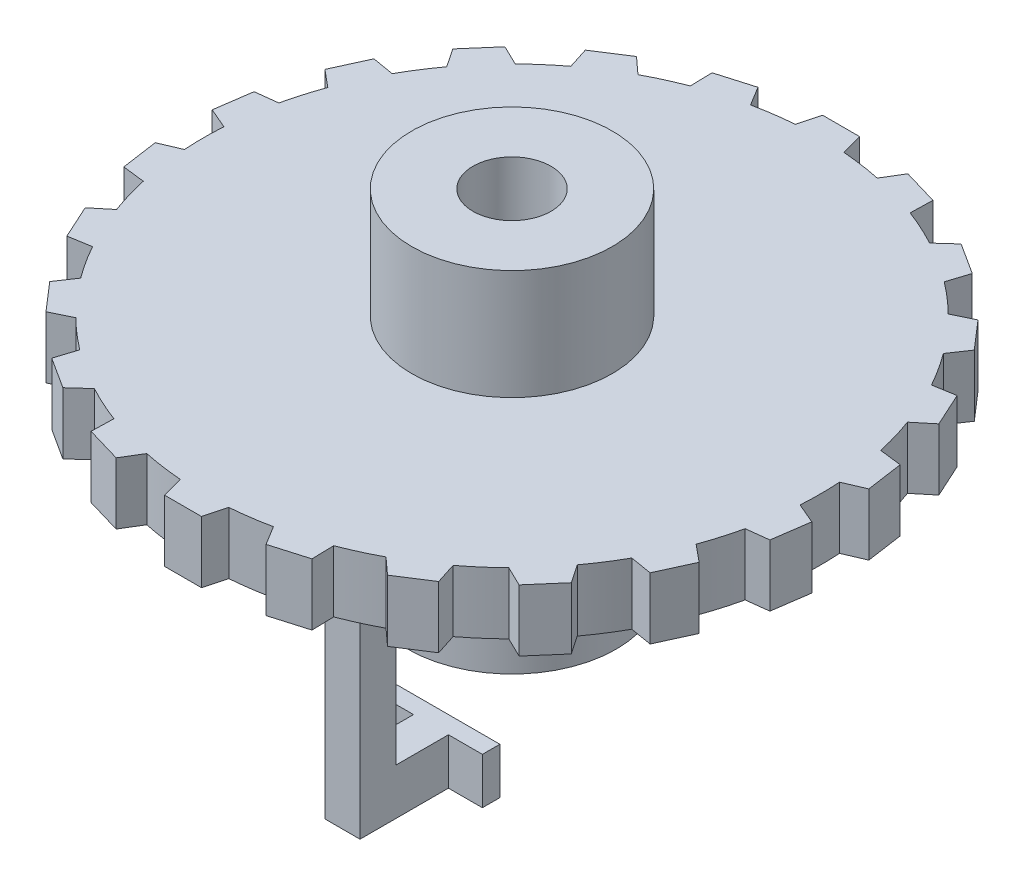
from build123d import *

# Parameters (mm, degrees)
SKETCH1_R           = 30
BOSS_EXTRUDE3_DEPTH = 6
BOSS_EXTRUDE2_DEPTH = 6
CIRPATTERN3_COUNT   = 22
SKETCH5_R           = 9.75
BOSS_EXTRUDE4_DEPTH = 10.7
SKETCH6_R           = 3.8
CUT_EXTRUDE1_DEPTH  = 49.191740155
SKETCH7_R           = 10.15
BOSS_EXTRUDE5_DEPTH = 17
SKETCH8_R           = 7.25
CUT_EXTRUDE2_DEPTH  = 17
BOSS_EXTRUDE6_DEPTH = 6
SKETCH10_W          = 3.399512937
SKETCH10_H          = 25
BOSS_EXTRUDE7_DEPTH = 3.5
SKETCH11_W          = 3.399512937
SKETCH11_H          = 4.5
BOSS_EXTRUDE8_DEPTH = 5.1
SKETCH12_W          = 10
SKETCH12_H          = 4.5
BOSS_EXTRUDE9_DEPTH = 1.7
SKETCH13_W          = 2.5
SKETCH13_H          = 2.5
CUT_EXTRUDE3_DEPTH  = 65.791238635


with BuildPart() as part:
    # Sketch1 → Boss-Extrude3 (new body)
    with BuildSketch(Plane(origin=(0, 0, 0), x_dir=(1, 0, 0), z_dir=(0, 1, 0))):
        Circle(SKETCH1_R)
    extrude(amount=BOSS_EXTRUDE3_DEPTH)

    # Sketch2 → Boss-Extrude2 (add)
    with BuildSketch(Plane(origin=(0, 6, 0), x_dir=(1, 0, 0), z_dir=(0, 1, 0))):
        Polygon((0, 32), (1.8, 32), (3.141154031, 26.994745017), (0, 26.994745017), (-3.141154031, 26.994745017), (-1.8, 32), align=None)
    boss_extrude2 = extrude(amount=-BOSS_EXTRUDE2_DEPTH)

    # CirPattern3: Boss-Extrude2 ×22 about axis
    cirpattern3_axis = Axis((0, 6, 0), (0, -1, 0))
    for i in range(1, CIRPATTERN3_COUNT):
        add(boss_extrude2.rotate(cirpattern3_axis, i * 360 / CIRPATTERN3_COUNT))

    # Sketch5 → Boss-Extrude4 (add)
    with BuildSketch(Plane(origin=(0, 6, 0), x_dir=(1, 0, 0), z_dir=(0, 1, 0))):
        Circle(SKETCH5_R)
    extrude(amount=BOSS_EXTRUDE4_DEPTH)

    # Sketch6 → Cut-Extrude1 (cut, through all)
    with BuildSketch(Plane(origin=(0, 16.7, 0), x_dir=(1, 0, 0), z_dir=(0, 1, 0))):
        Circle(SKETCH6_R)
    extrude(amount=-CUT_EXTRUDE1_DEPTH, mode=Mode.SUBTRACT)

    # Sketch7 → Boss-Extrude5 (add)
    with BuildSketch(Plane.XZ):
        Circle(SKETCH7_R)
    extrude(amount=BOSS_EXTRUDE5_DEPTH)

    # Sketch8 → Cut-Extrude2 (cut)
    with BuildSketch(Plane.XZ.offset(17)):
        Circle(SKETCH8_R)
    extrude(amount=-CUT_EXTRUDE2_DEPTH, mode=Mode.SUBTRACT)

    # Sketch13 → Cut-Extrude3 (cut, through all)
    with BuildSketch(Plane.XY.offset(16.15)):
        with Locations((4.619923644, -5.574533837)):
            Rectangle(SKETCH13_W, SKETCH13_H)
    extrude(amount=-CUT_EXTRUDE3_DEPTH, mode=Mode.SUBTRACT)


with BuildPart() as body_2:
    # 3DSketch1 → Boss-Extrude6 (new body)
    with BuildSketch(Plane(origin=(-2.029589293, -4.324533837, 10.15), x_dir=(0.5806594323219183, -0.8141465615327426, 0), z_dir=(0, 0, 1))):
        Polygon((0, 0), (1.973959252, 2.767701768), (5.85457283, 0), (3.880613579, -2.767701768), align=None)
    extrude(amount=BOSS_EXTRUDE6_DEPTH)

    # Sketch10 → Boss-Extrude7 (add)
    with BuildSketch(Plane.XY.offset(16.15)):
        with Locations((-0.329832824, -16.824533837)):
            Rectangle(SKETCH10_W, SKETCH10_H)
    extrude(amount=-BOSS_EXTRUDE7_DEPTH)

    # Sketch11 → Boss-Extrude8 (add)
    with BuildSketch(Plane(origin=(0, 0, 12.65), x_dir=(-1, 0, 0), z_dir=(0, 0, -1))):
        with Locations((0.329832824, -27.074533837)):
            Rectangle(SKETCH11_W, SKETCH11_H)
    extrude(amount=BOSS_EXTRUDE8_DEPTH)

    # Sketch12 → Boss-Extrude9 (add)
    with BuildSketch(Plane(origin=(0, 0, 7.55), x_dir=(-1, 0, 0), z_dir=(0, 0, -1))):
        with Locations((0.329832824, -27.074533837)):
            Rectangle(SKETCH12_W, SKETCH12_H)
    extrude(amount=BOSS_EXTRUDE9_DEPTH)


solid = Compound([part.part, body_2.part])
